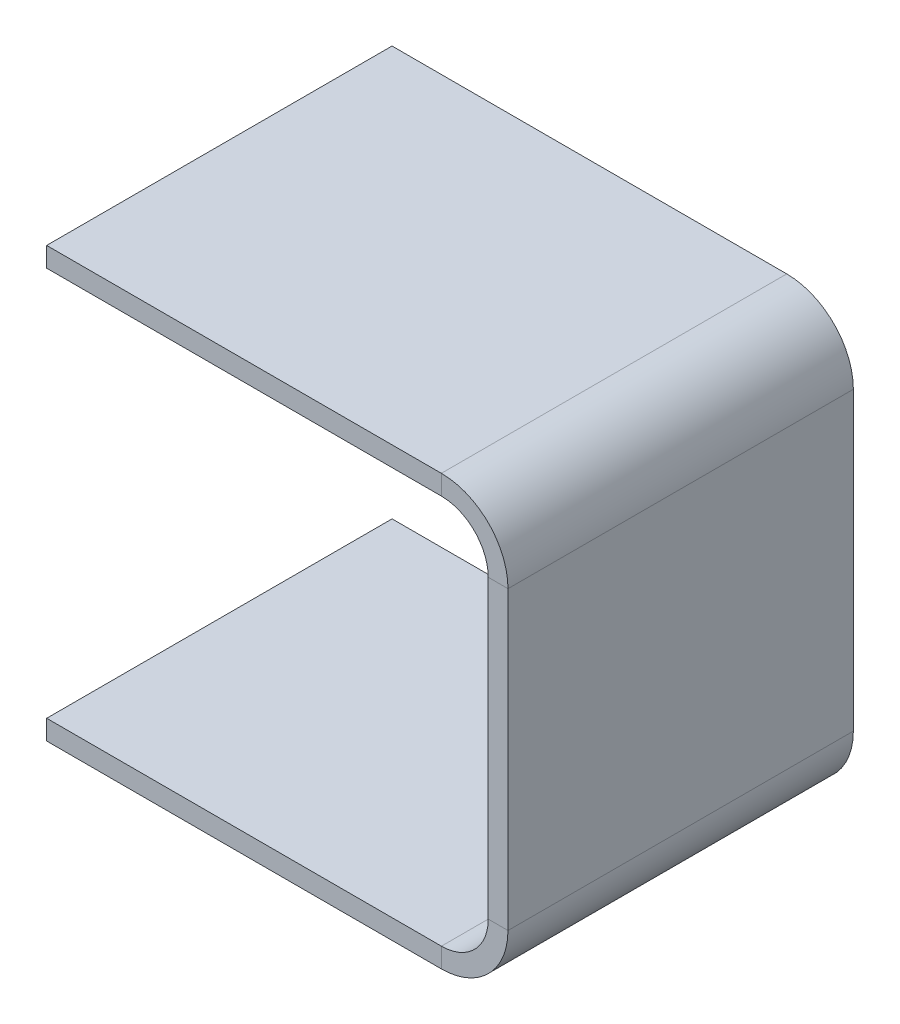
from build123d import *

# Parameters (mm, degrees)
BOSS_EXTRUDE1_DEPTH  = 35
CONVERT_SOLID1_DEPTH = 35


# Read off the part's stored shape, not the designer's step: Convert-Solid1
with BuildPart() as part:
    # Sketch1 → Boss-Extrude1 (new body)
    with BuildSketch(Plane.XY):
        with BuildLine():
            Line((0, 0), (40, 0))
            ThreePointArc((40, 0), (44.770067359, 1.975826594), (46.745893953, 6.745893953))
            Line((46.745893953, 6.745893953), (46.745893953, 36.745893953))
            ThreePointArc((46.745893953, 36.745893953), (44.768864726, 41.518864726), (39.995893953, 43.495893953))
            Line((39.995893953, 43.495893953), (-0.004106047, 43.495893953))
            Line((-0.004106047, 43.495893953), (-0.004106047, 41.995893953))
            Line((-0.004106047, 41.995893953), (39.995893953, 41.995893953))
            ThreePointArc((39.995893953, 41.995893953), (43.708204554, 40.458204554), (45.245893953, 36.745893953))
            Line((45.245893953, 36.745893953), (45.245893953, 6.75))
            ThreePointArc((45.245893953, 6.75), (43.708204554, 3.037689399), (39.995893953, 1.5))
            Line((39.995893953, 1.5), (0, 1.5))
            Line((0, 1.5), (0, 0))
        make_face()
    extrude(amount=BOSS_EXTRUDE1_DEPTH)

    # Convert-Solid1 outline → Convert-Solid1 (add)
    with BuildSketch(Plane.XY):
        with BuildLine():
            Line((39.995893953, 41.995893953), (-0.004106047, 41.995893953))
            Line((-0.004106047, 41.995893953), (-0.004106047, 41.495893953))
            Line((-0.004106047, 41.495893953), (39.995893953, 41.495893953))
            ThreePointArc((39.995893953, 41.495893953), (43.354651163, 40.104651163), (44.745893953, 36.745893953))
            Line((44.745893953, 36.745893953), (44.745893953, 6.745893953))
            ThreePointArc((44.745893953, 6.745893953), (43.355853797, 3.390040156), (40, 2))
            Line((40, 2), (0, 2))
            Line((0, 2), (0, 1.5))
            Line((0, 1.5), (39.995893953, 1.5))
            ThreePointArc((39.995893953, 1.5), (43.708204554, 3.037689399), (45.245893953, 6.75))
            Line((45.245893953, 6.75), (45.245893953, 36.745893953))
            ThreePointArc((45.245893953, 36.745893953), (43.708204554, 40.458204554), (39.995893953, 41.995893953))
        make_face()
    extrude(amount=CONVERT_SOLID1_DEPTH)


solid = part.part
